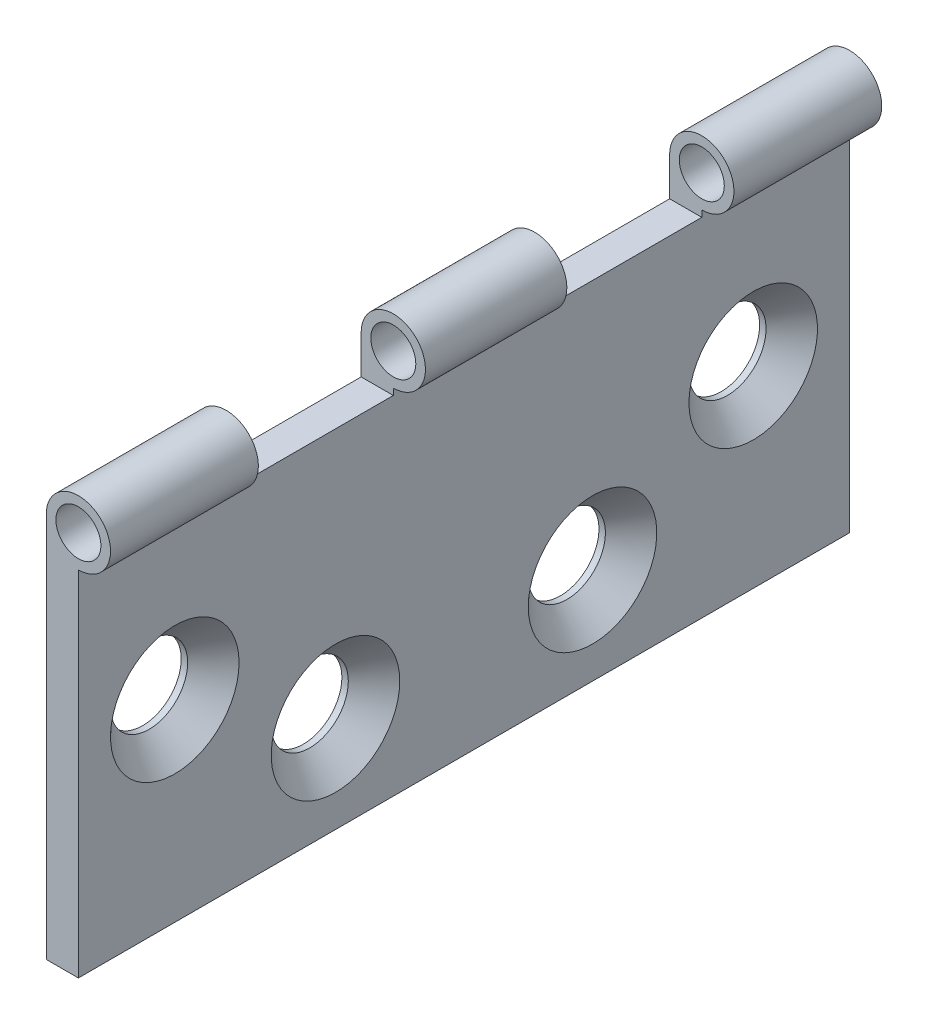
from build123d import *

# Parameters (mm, degrees)
SKETCH_1_W                  = 5
SKETCH_1_H                  = 60
EXTRUDE_2_DEPTH             = 60
SKETCH_2_R                  = 5
SKETCH_3_R                  = 3.5
CUT_EXTRUDE_1_DEPTH         = 137.839321834
HOLE_WIZARD_M101_AT_2_COUNT = 2
HOLE_WIZARD_M101_AT_2_PITCH = 29.154759474
CUT_EXTRUDE_3_DEPTH         = 10
CUT_EXTRUDE_3_DEPTH_BACK    = 10
SKETCH_12_W                 = 26
SKETCH_12_H                 = 11


with BuildPart() as part:
    # Эскиз1 → Вытянуть-Тонкостенный2 (new, symmetric)
    with BuildSketch(Plane.XY):
        with Locations((2.5, 30)):
            Rectangle(SKETCH_1_W, SKETCH_1_H)
    extrude(amount=EXTRUDE_2_DEPTH, both=True)

    # По траектории1: sweep along a curve in space
    with BuildLine() as sweep_1_path:
        Line((0, 60, 60), (0, 60, -60))
    # Эскиз2 → По траектории1 (sweep)
    with BuildSketch(Plane.XY.offset(60)):
        with Locations((5, 60)):
            Circle(SKETCH_2_R)
    sweep(path=sweep_1_path.line)

    # Эскиз3 → Вырез-Вытянуть1 (cut, through all)
    with BuildSketch(Plane.XY.offset(60)):
        with Locations((5, 60)):
            Circle(SKETCH_3_R)
    extrude(amount=-CUT_EXTRUDE_1_DEPTH, mode=Mode.SUBTRACT)

    # Эскиз8 → Зенковка для  винта с плоской головкой M101 (revolve, cut)
    with BuildSketch(Plane(origin=(5, 30, 45), x_dir=(0, 0, -1), z_dir=(0, 1, 0))):
        Polygon((0, 0), (0, 5), (6, 5), (6, 4), (10, 0), align=None)
    hole_wizard_m101 = revolve(axis=Axis((11.35, 30, 45), (-1, 0, 0)), mode=Mode.SUBTRACT)

    # Зенковка для  винта с плоской головкой M101 at 2: Зенковка для  винта с плоской головкой M101 ×2
    with Locations(*[Vector(0, -0.5144957554275265, -0.8574929257125442) * (i * HOLE_WIZARD_M101_AT_2_PITCH) for i in range(1, HOLE_WIZARD_M101_AT_2_COUNT)]):
        add(hole_wizard_m101, mode=Mode.SUBTRACT)

    # Зеркальное отражение1: Зенковка для  винта с плоской головкой M101 across plane
    add(hole_wizard_m101.mirror(Plane.XY), mode=Mode.SUBTRACT)

    # Зеркальное отражение1 copy 1 sketch → Зеркальное отражение1 copy 1 (revolve, cut)
    with BuildSketch(Plane(origin=(5, 15, -20), x_dir=(0, 0, 1), z_dir=(0, 1, 0))):
        Polygon((0, 0), (0, -5), (6, -5), (6, -4), (10, 0), align=None)
    revolve(axis=Axis((11.35, 15, -20), (1, 0, 0)), mode=Mode.SUBTRACT)

    # Эскиз12 → Вырез-Вытянуть3 (cut, two sides: drawn at the far end of the back side and taken through both)
    with BuildSketch(Plane(origin=(5, 0, 0), x_dir=(0, 0, -1), z_dir=(1, 0, 0)).offset(-CUT_EXTRUDE_3_DEPTH_BACK)):
        with Locations((-24, 59.5)):
            Rectangle(SKETCH_12_W, SKETCH_12_H)
        with Locations((24, 59.5)):
            Rectangle(SKETCH_12_W, SKETCH_12_H)
    extrude(amount=CUT_EXTRUDE_3_DEPTH + CUT_EXTRUDE_3_DEPTH_BACK, mode=Mode.SUBTRACT)


solid = part.part
